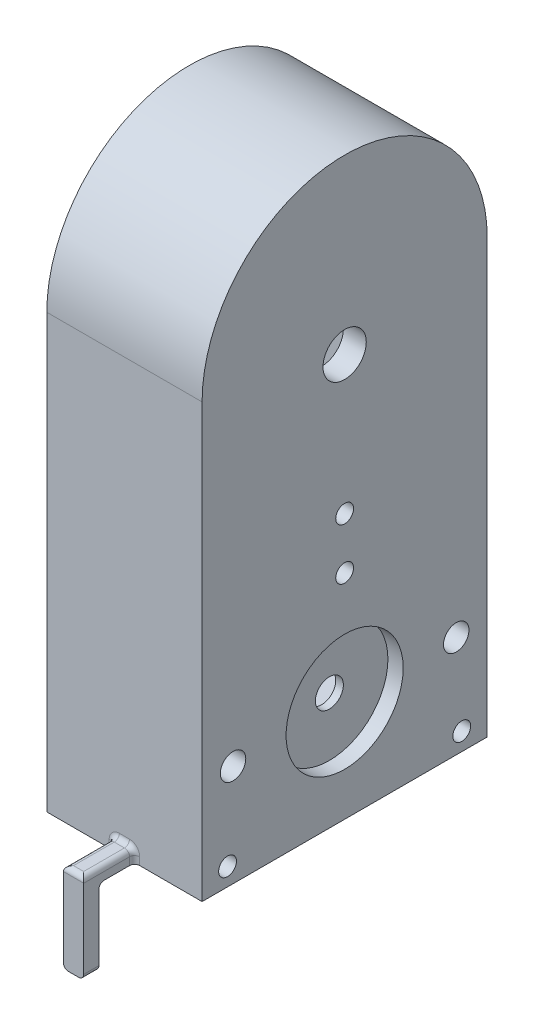
from build123d import *

# Parameters (mm, degrees)
SKETCH2_W           = 30.5
SKETCH2_H           = 56
BOSS_EXTRUDE3_DEPTH = 85
SKETCH2_5_R         = 4.25
SKETCH2_5_R_2       = 2.25
CUT_EXTRUDE1_DEPTH  = 31.75
BOSS_EXTRUDE4_DEPTH = 30.5
CUT_EXTRUDE2_DEPTH  = 26
SKETCH5_R           = 2.75
SKETCH5_R_2         = 4.25
SKETCH5_R_3         = 1.75
CUT_EXTRUDE3_DEPTH  = 10
SKETCH7_R           = 11.5
CUT_EXTRUDE5_DEPTH  = 3
SKETCH9_R           = 1.75
CUT_EXTRUDE7_DEPTH  = 77
SKETCH6_R           = 2.5
SKETCH6_R_2         = 1.75
CUT_EXTRUDE8_DEPTH  = 77
BOSS_EXTRUDE5_DEPTH = 10
SKETCH12_W          = 4
SKETCH12_H          = 3
BOSS_EXTRUDE6_DEPTH = 15
FILLET2_R           = 1


with BuildPart() as part:
    # Sketch2 → Boss-Extrude3 (new body)
    with BuildSketch(Plane(origin=(0, 0, 0), x_dir=(1, 0, 0), z_dir=(0, 1, 0))):
        with Locations((15.25, -28)):
            Rectangle(SKETCH2_W, SKETCH2_H)
    extrude(amount=BOSS_EXTRUDE3_DEPTH)

    # Sketch2<5> → Cut-Extrude1 (cut)
    with BuildSketch(Plane(origin=(0, 0, 0), x_dir=(1, 0, 0), z_dir=(0, 1, 0))):
        with Locations((12.5, -28)):
            Circle(SKETCH2_5_R)
        with Locations((20.9852814, -19.514718652)):
            Circle(SKETCH2_5_R_2)
        with Locations((20.9852814, -36.485281348)):
            Circle(SKETCH2_5_R_2)
        with Locations((4.0147186, -19.514718652)):
            Circle(SKETCH2_5_R_2)
        with Locations((4.0147186, -36.485281348)):
            Circle(SKETCH2_5_R_2)
    extrude(amount=CUT_EXTRUDE1_DEPTH, mode=Mode.SUBTRACT)

    # Sketch4 → Boss-Extrude4 (add)
    with BuildSketch(Plane(origin=(30.5, 0, 0), x_dir=(0, 0, -1), z_dir=(1, 0, 0))):
        with BuildLine():
            Line((-56, 85), (0, 85))
            ThreePointArc((0, 85), (-28, 113), (-56, 85))
        make_face()
    extrude(amount=-BOSS_EXTRUDE4_DEPTH)

    # Sketch3 → Cut-Extrude2 (cut)
    with BuildSketch(Plane.ZY):
        with BuildLine():
            Line((5, 10), (5, 80))
            Line((5, 80), (5, 85))
            ThreePointArc((5, 85), (28, 108), (51, 85))
            Line((51, 85), (51, 80))
            Line((51, 80), (51, 10))
            Line((51, 10), (51, 7))
            Line((51, 7), (5, 7))
            Line((5, 7), (5, 10))
        make_face()
    extrude(amount=-CUT_EXTRUDE2_DEPTH, mode=Mode.SUBTRACT)

    # Sketch5 → Cut-Extrude3 (cut)
    with BuildSketch(Plane.ZY.offset(-26)):
        with Locations((28, 20)):
            Circle(SKETCH5_R)
        with Locations((28, 79.06)):
            Circle(SKETCH5_R_2)
        with Locations((28, 52)):
            Circle(SKETCH5_R_3)
    extrude(amount=-CUT_EXTRUDE3_DEPTH, mode=Mode.SUBTRACT)

    # Sketch7 → Cut-Extrude5 (cut)
    with BuildSketch(Plane(origin=(30.5, 0, 0), x_dir=(0, 0, -1), z_dir=(1, 0, 0))):
        with Locations((-28, 20)):
            Circle(SKETCH7_R)
    extrude(amount=-CUT_EXTRUDE5_DEPTH, mode=Mode.SUBTRACT)

    # Sketch9 → Cut-Extrude7 (cut)
    with BuildSketch(Plane.ZY):
        with Locations((5, 3.5)):
            Circle(SKETCH9_R)
        with Locations((51, 3.5)):
            Circle(SKETCH9_R)
    extrude(amount=-CUT_EXTRUDE7_DEPTH, mode=Mode.SUBTRACT)

    # Sketch6 → Cut-Extrude8 (cut)
    with BuildSketch(Plane(origin=(30.5, 0, 0), x_dir=(0, 0, -1), z_dir=(1, 0, 0))):
        with Locations((-49.92, 20)):
            Circle(SKETCH6_R)
        with Locations((-6.08, 20)):
            Circle(SKETCH6_R)
        with Locations((-28, 41.92)):
            Circle(SKETCH6_R_2)
    extrude(amount=-CUT_EXTRUDE8_DEPTH, mode=Mode.SUBTRACT)

    # Sketch11 → Boss-Extrude5 (add)
    with BuildSketch(Plane.XY.offset(56)):
        Polygon((15.25, 2.5), (17.25, 2.5), (17.25, 0), (15.25, 0), (13.25, 0), (13.25, 2.5), align=None)
    extrude(amount=BOSS_EXTRUDE5_DEPTH)

    # Sketch12 → Boss-Extrude6 (add)
    with BuildSketch(Plane.XZ):
        with Locations((15.25, 64.5)):
            Rectangle(SKETCH12_W, SKETCH12_H)
    extrude(amount=BOSS_EXTRUDE6_DEPTH)

    # Fillet2
    fillet2_edges = [part.edges().sort_by_distance(p)[0] for p in [
        (17.25, -15, 64.5),
        (13.25, -15, 64.5),
        (15.25, 2.5, 66),
        (17.25, 1.25, 56),
        (13.25, 1.25, 56),
        (15.25, 2.5, 56),
        (15.25, 0, 63),
        (17.25, 2.5, 61),
        (13.25, 2.5, 61),
    ]]
    fillet(fillet2_edges, radius=FILLET2_R)


solid = part.part
